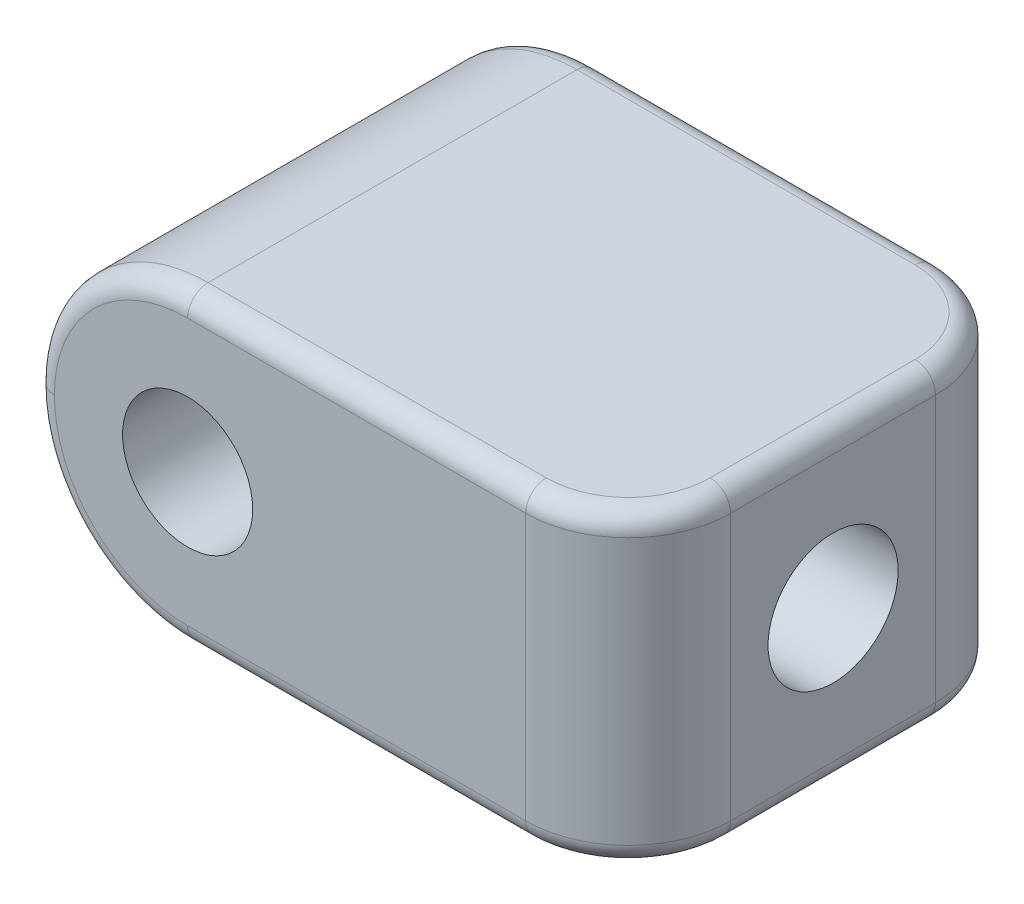
from build123d import *

# Parameters (mm, degrees)
SKETCH1_W               = 29
SKETCH1_H               = 20
BOSS_EXTRUDE1_DEPTH     = 7.5
SKETCH2_R               = 3.175
CUT_EXTRUDE1_DEPTH      = 26.816661287
FILLET2_R               = 7.5
CUT_EXTRUDE2_REACH      = 33.579
CUT_EXTRUDE2_END_RADIUS = 3.175
SKETCH3_R               = 3.175
FILLET3_R               = 5
FILLET4_R               = 1


with BuildPart() as part:
    # Sketch1 → Boss-Extrude1 (new, symmetric)
    with BuildSketch(Plane(origin=(0, 0, 0), x_dir=(1, 0, 0), z_dir=(0, 1, 0))):
        Rectangle(SKETCH1_W, SKETCH1_H)
    extrude(amount=BOSS_EXTRUDE1_DEPTH, both=True)

    # Sketch2 → Cut-Extrude1 (cut, through all)
    with BuildSketch(Plane.XY.offset(10)):
        with Locations((-7, 0)):
            Circle(SKETCH2_R)
    extrude(amount=-CUT_EXTRUDE1_DEPTH, mode=Mode.SUBTRACT)

    # Fillet2
    fillet2_edges = [part.edges().sort_by_distance(p)[0] for p in [
        (-14.5, 7.5, 0),
        (-14.5, -7.5, 0),
    ]]
    fillet(fillet2_edges, radius=FILLET2_R - 0.0001)  # a hair under: the kernel refuses the full size

    # Cut-Extrude2: up to this cylinder (the profile starts outside it)
    cut_extrude2_end = Plane(origin=(-7, 0, 0), z_dir=(0, 0, 1)) * Cylinder(CUT_EXTRUDE2_END_RADIUS, 74.508, mode=Mode.PRIVATE)
    # Sketch3 → Cut-Extrude2 (cut, up to the surface)
    with BuildSketch(Plane(origin=(14.5, 0, 0), x_dir=(0, 0, -1), z_dir=(1, 0, 0)), mode=Mode.PRIVATE) as cut_extrude2_sk1:
        Circle(SKETCH3_R)
    cut_extrude2_tool1 = extrude(cut_extrude2_sk1.sketch, amount=-CUT_EXTRUDE2_REACH, mode=Mode.PRIVATE) - cut_extrude2_end
    add(cut_extrude2_tool1.solids().sort_by_distance((14.5, 0, 0))[0], mode=Mode.SUBTRACT)

    # Fillet3
    fillet3_edges = [part.edges().sort_by_distance(p)[0] for p in [
        (14.5, 0, -10),
        (14.5, 0, 10),
    ]]
    fillet(fillet3_edges, radius=FILLET3_R)

    # Fillet4
    fillet4_edges = [part.edges().sort_by_distance(p)[0] for p in [
        (1.24995, 7.5, 10),
        (1.24995, -7.5, 10),
        (-12.303330148, -5.303330148, 10),
        (-12.303330148, 5.303330148, 10),
        (-12.303330148, -5.303330148, -10),
        (-12.303330148, 5.303330148, -10),
        (1.24995, 7.5, -10),
        (1.24995, -7.5, -10),
        (14.5, -7.5, 0),
        (13.035533906, -7.5, 8.535533906),
        (13.035533906, -7.5, -8.535533906),
        (14.5, 7.5, 0),
        (13.035533906, 7.5, 8.535533906),
        (13.035533906, 7.5, -8.535533906),
    ]]
    fillet(fillet4_edges, radius=FILLET4_R)


solid = part.part
